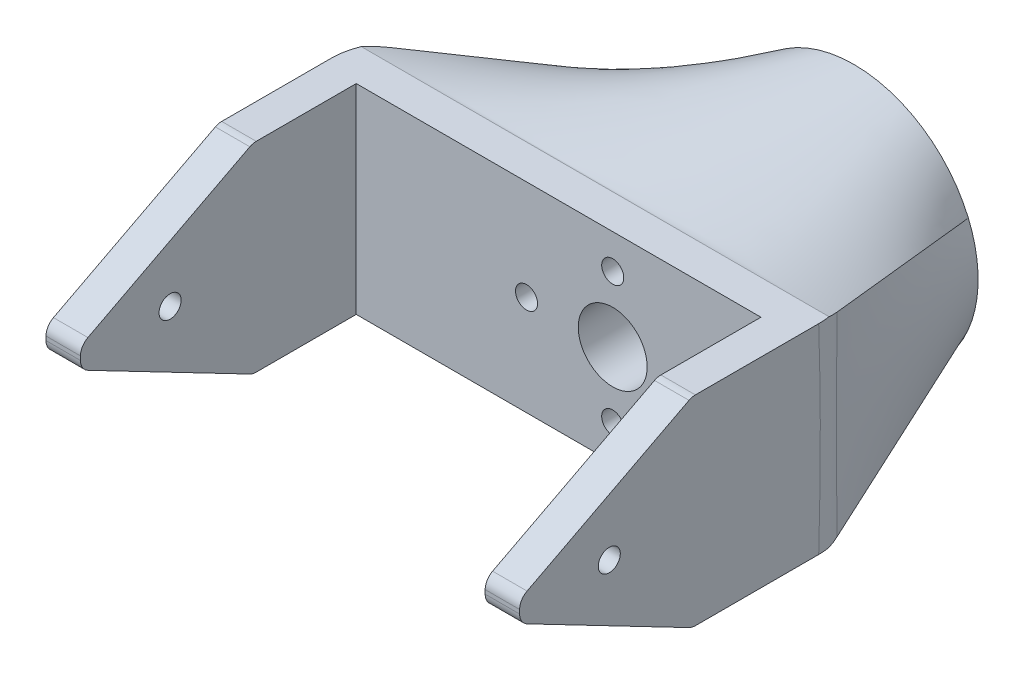
from build123d import *

# Parameters (mm, degrees)
BOSS_EXTRUDE1_DEPTH = 29
SKETCH2_R           = 1.6
CUT_EXTRUDE1_DEPTH  = 88.095866722
SKETCH8_R           = 5
SKETCH8_R_2         = 1.6
CUT_EXTRUDE3_DEPTH  = 107.775184478
CUT_EXTRUDE4_DEPTH  = 107.775184548
FILLET1_R           = 2
FILLET2_R           = 10


with BuildPart() as part:
    # Sketch1 → Boss-Extrude1 (new body)
    with BuildSketch(Plane(origin=(0, 0, 0), x_dir=(1, 0, 0), z_dir=(0, 1, 0))):
        Polygon((0, 0), (0, 45), (68.7, 45), (68.7, 0), (63.7, 0), (63.7, 40), (5, 40), (5, 0), align=None)
    extrude(amount=BOSS_EXTRUDE1_DEPTH)

    # Sketch2 → Cut-Extrude1 (cut, through all)
    with BuildSketch(Plane(origin=(68.7, 0, 0), x_dir=(0, 0, -1), z_dir=(1, 0, 0))):
        with Locations((13, 14.5)):
            Circle(SKETCH2_R)
    extrude(amount=-CUT_EXTRUDE1_DEPTH, mode=Mode.SUBTRACT)

    # Loft2: read off the stored shape, not the designer's step
    # Loft2: loft between two sections, ruled curve by curve
    loft2_from = [
        Edge.make_bspline([(58.7830687, 7.499869108, -75), (59.236789371, 8.574717733, -75), (59.594121179, 9.715673973, -75), (60.075863556, 12.071270035, -75), (60.2, 13.285510166, -75), (60.2, 15.714489834, -75), (60.075863556, 16.928729965, -75), (59.594121179, 19.284326027, -75), (59.236789371, 20.425282267, -75), (58.7830687, 21.500130892, -75)], [0, 0, 0, 0, 0.25, 0.25, 0.5, 0.5, 0.75, 0.75, 1, 1, 1, 1], 3),
        Edge.make_bspline([(58.7830687, 21.500130892, -75), (58.245644387, 22.773270556, -75), (57.518678604, 24.085542636, -75), (56.075347645, 25.993948982, -75), (55.535761632, 26.619337811, -75), (54.335762543, 27.820816595, -75), (53.675268026, 28.396824058, -75), (52.237826073, 29.468150951, -75), (51.460832799, 29.963342143, -75), (49.805218581, 30.841316492, -75), (48.926615313, 31.223945338, -75), (47.093581696, 31.849079498, -75), (46.13924648, 32.091442444, -75), (44.189865052, 32.41694581, -75), (43.194978913, 32.5, -75), (41.205021087, 32.5, -75), (40.210134948, 32.41694581, -75), (38.26075352, 32.091442444, -75), (37.306418304, 31.849079498, -75), (35.473384687, 31.223945338, -75), (34.594781419, 30.841316492, -75), (32.939167201, 29.963342143, -75), (32.162173927, 29.468150951, -75), (30.724731974, 28.396824058, -75), (30.064237457, 27.820816595, -75), (28.864238368, 26.619337811, -75), (28.324652355, 25.993948982, -75), (26.881321396, 24.085542636, -75), (26.154355613, 22.773270556, -75), (25.6169313, 21.500130892, -75)], [0, 0, 0, 0, 0.125, 0.125, 0.1875, 0.1875, 0.25, 0.25, 0.3125, 0.3125, 0.375, 0.375, 0.4375, 0.4375, 0.5, 0.5, 0.5625, 0.5625, 0.625, 0.625, 0.6875, 0.6875, 0.75, 0.75, 0.8125, 0.8125, 0.875, 0.875, 1, 1, 1, 1], 3),
        Edge.make_bspline([(25.6169313, 7.499869108, -75), (26.154355613, 6.226729444, -75), (26.881321396, 4.914457364, -75), (28.324652355, 3.006051018, -75), (28.864238368, 2.380662189, -75), (30.064237457, 1.179183405, -75), (30.724731974, 0.603175942, -75), (32.162173927, -0.468150951, -75), (32.939167201, -0.963342143, -75), (34.594781419, -1.841316492, -75), (35.473384687, -2.223945338, -75), (37.306418304, -2.849079498, -75), (38.26075352, -3.091442444, -75), (40.210134948, -3.41694581, -75), (41.205021087, -3.5, -75), (43.194978913, -3.5, -75), (44.189865052, -3.41694581, -75), (46.13924648, -3.091442444, -75), (47.093581696, -2.849079498, -75), (48.926615313, -2.223945338, -75), (49.805218581, -1.841316492, -75), (51.460832799, -0.963342143, -75), (52.237826073, -0.468150951, -75), (53.675268026, 0.603175942, -75), (54.335762543, 1.179183405, -75), (55.535761632, 2.380662189, -75), (56.075347645, 3.006051018, -75), (57.518678604, 4.914457364, -75), (58.245644387, 6.226729444, -75), (58.7830687, 7.499869108, -75)], [0, 0, 0, 0, 0.125, 0.125, 0.1875, 0.1875, 0.25, 0.25, 0.3125, 0.3125, 0.375, 0.375, 0.4375, 0.4375, 0.5, 0.5, 0.5625, 0.5625, 0.625, 0.625, 0.6875, 0.6875, 0.75, 0.75, 0.8125, 0.8125, 0.875, 0.875, 1, 1, 1, 1], 3),
        Edge.make_bspline([(25.6169313, 21.500130892, -75), (25.163210629, 20.425282267, -75), (24.805878821, 19.284326027, -75), (24.324136444, 16.928729965, -75), (24.2, 15.714489834, -75), (24.2, 13.285510166, -75), (24.324136444, 12.071270035, -75), (24.805878821, 9.715673973, -75), (25.163210629, 8.574717733, -75), (25.6169313, 7.499869108, -75)], [0, 0, 0, 0, 0.25, 0.25, 0.5, 0.5, 0.75, 0.75, 1, 1, 1, 1], 3),
    ]
    loft2_to = [
        Edge.make_bspline([(68.7, 0, -45), (68.7, 2.416666667, -45), (68.7, 4.833333333, -45), (68.7, 9.666666667, -45), (68.7, 12.083333333, -45), (68.7, 16.916666667, -45), (68.7, 19.333333333, -45), (68.7, 24.166666667, -45), (68.7, 26.583333333, -45), (68.7, 29, -45)], [0, 0, 0, 0, 0.25, 0.25, 0.5, 0.5, 0.75, 0.75, 1, 1, 1, 1], 3),
        Edge.make_bspline([(68.7, 29, -45), (65.8375, 29, -45), (62.975, 29, -45), (58.68125, 29, -45), (57.25, 29, -45), (54.3875, 29, -45), (52.95625, 29, -45), (50.09375, 29, -45), (48.6625, 29, -45), (45.8, 29, -45), (44.36875, 29, -45), (41.50625, 29, -45), (40.075, 29, -45), (37.2125, 29, -45), (35.78125, 29, -45), (32.91875, 29, -45), (31.4875, 29, -45), (28.625, 29, -45), (27.19375, 29, -45), (24.33125, 29, -45), (22.9, 29, -45), (20.0375, 29, -45), (18.60625, 29, -45), (15.74375, 29, -45), (14.3125, 29, -45), (11.45, 29, -45), (10.01875, 29, -45), (5.725, 29, -45), (2.8625, 29, -45), (0, 29, -45)], [0, 0, 0, 0, 0.125, 0.125, 0.1875, 0.1875, 0.25, 0.25, 0.3125, 0.3125, 0.375, 0.375, 0.4375, 0.4375, 0.5, 0.5, 0.5625, 0.5625, 0.625, 0.625, 0.6875, 0.6875, 0.75, 0.75, 0.8125, 0.8125, 0.875, 0.875, 1, 1, 1, 1], 3),
        Edge.make_bspline([(0, 0, -45), (2.8625, 0, -45), (5.725, 0, -45), (10.01875, 0, -45), (11.45, 0, -45), (14.3125, 0, -45), (15.74375, 0, -45), (18.60625, 0, -45), (20.0375, 0, -45), (22.9, 0, -45), (24.33125, 0, -45), (27.19375, 0, -45), (28.625, 0, -45), (31.4875, 0, -45), (32.91875, 0, -45), (35.78125, 0, -45), (37.2125, 0, -45), (40.075, 0, -45), (41.50625, 0, -45), (44.36875, 0, -45), (45.8, 0, -45), (48.6625, 0, -45), (50.09375, 0, -45), (52.95625, 0, -45), (54.3875, 0, -45), (57.25, 0, -45), (58.68125, 0, -45), (62.975, 0, -45), (65.8375, 0, -45), (68.7, 0, -45)], [0, 0, 0, 0, 0.125, 0.125, 0.1875, 0.1875, 0.25, 0.25, 0.3125, 0.3125, 0.375, 0.375, 0.4375, 0.4375, 0.5, 0.5, 0.5625, 0.5625, 0.625, 0.625, 0.6875, 0.6875, 0.75, 0.75, 0.8125, 0.8125, 0.875, 0.875, 1, 1, 1, 1], 3),
        Edge.make_bspline([(0, 29, -45), (0, 26.583333333, -45), (0, 24.166666667, -45), (0, 19.333333333, -45), (0, 16.916666667, -45), (0, 12.083333333, -45), (0, 9.666666667, -45), (0, 4.833333333, -45), (0, 2.416666667, -45), (0, 0, -45)], [0, 0, 0, 0, 0.25, 0.25, 0.5, 0.5, 0.75, 0.75, 1, 1, 1, 1], 3),
    ]
    loft2 = Solid(Shell([*[Face.make_surface_from_curves(loft2_from[k], loft2_to[k]) for k in range(4)], Face(Wire(loft2_from)), Face(Wire(loft2_to))]))
    add(loft2)

    # Sketch8 → Cut-Extrude3 (cut, through all)
    with BuildSketch(Plane(origin=(0, 0, -75), x_dir=(-1, 0, 0), z_dir=(0, 0, -1))):
        with Locations((-42.2, 14.5)):
            Circle(SKETCH8_R)
        with Locations((-42.2, 24)):
            Circle(SKETCH8_R_2)
        with Locations((-29.7, 14.5)):
            Circle(SKETCH8_R_2)
        with Locations((-42.2, 5)):
            Circle(SKETCH8_R_2)
        with Locations((-54.7, 14.5)):
            Circle(SKETCH8_R_2)
    extrude(amount=-CUT_EXTRUDE3_DEPTH, mode=Mode.SUBTRACT)

    # Sketch9 → Cut-Extrude4 (cut, through all)
    with BuildSketch(Plane(origin=(68.7, 0, 0), x_dir=(0, 0, -1), z_dir=(1, 0, 0))):
        Polygon((0, 13), (25, 0), (0, 0), align=None)
        Polygon((0, 16), (25, 29), (0, 29), align=None)
    extrude(amount=-CUT_EXTRUDE4_DEPTH, mode=Mode.SUBTRACT)

    # Fillet1
    fillet1_edges = [part.edges().sort_by_distance(p)[0] for p in [
        (2.5, 16, 0),
        (66.2, 16, 0),
        (66.2, 0, -25),
        (2.5, 0, -25),
        (66.2, 29, -25),
        (2.5, 29, -25),
        (2.5, 13, 0),
        (66.2, 13, 0),
    ]]
    fillet(fillet1_edges, radius=FILLET1_R)

    # Fillet2
    fillet2_edges = [part.edges().sort_by_distance(p)[0] for p in [
        (68.7, 14.5, -45),
        (0, 14.5, -45),
    ]]
    fillet(fillet2_edges, radius=FILLET2_R)


solid = part.part
